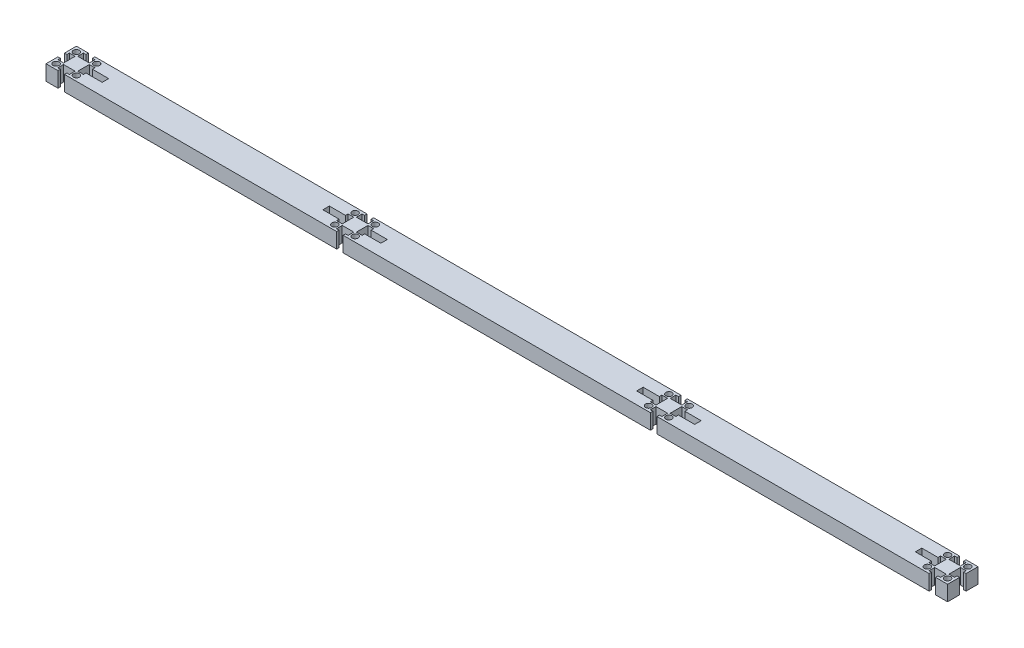
from build123d import *

# Parameters (mm, degrees)
SKETCH1_R           = 1.5
BOSS_EXTRUDE1_DEPTH = 7.5


with BuildPart() as part:
    # Sketch1 → Boss-Extrude1 (new body)
    with BuildSketch(Plane(origin=(0, 0, 0), x_dir=(1, 0, 0), z_dir=(0, 1, 0))):
        Polygon((0, 5.9), (0, 0), (5.9, 0), (5.9, 1.2), (4.65, 1.2), (4.65, 4), (10.35, 4), (10.35, 1.2), (9.1, 1.2), (9.1, 0), (143.3, 0), (143.3, 1.2), (142.05, 1.2), (142.05, 4), (147.75, 4), (147.75, 1.2), (146.5, 1.2), (146.5, 0), (298, 0), (298, 1.2), (296.75, 1.2), (296.75, 4), (302.45, 4), (302.45, 1.2), (301.2, 1.2), (301.2, 0), (435.4, 0), (435.4, 1.2), (434.15, 1.2), (434.15, 4), (439.85, 4), (439.85, 1.2), (438.6, 1.2), (438.6, 0), (444.5, 0), (444.5, 5.9), (443.3, 5.9), (443.3, 4.65), (440.5, 4.65), (440.5, 10.35), (443.3, 10.35), (443.3, 9.1), (444.5, 9.1), (444.5, 15), (438.6, 15), (438.6, 13.8), (439.85, 13.8), (439.85, 11), (434.15, 11), (434.15, 13.8), (435.4, 13.8), (435.4, 15), (301.2, 15), (301.2, 13.8), (302.45, 13.8), (302.45, 11), (296.75, 11), (296.75, 13.8), (298, 13.8), (298, 15), (146.5, 15), (146.5, 13.8), (147.75, 13.8), (147.75, 11), (142.05, 11), (142.05, 13.8), (143.3, 13.8), (143.3, 15), (9.1, 15), (9.1, 13.8), (10.35, 13.8), (10.35, 11), (4.65, 11), (4.65, 13.8), (5.9, 13.8), (5.9, 15), (0, 15), (0, 9.1), (1.2, 9.1), (1.2, 10.35), (4, 10.35), (4, 4.65), (1.2, 4.65), (1.2, 5.9), align=None)
        with Locations((2.5, 2.5)):
            Circle(SKETCH1_R, mode=Mode.SUBTRACT)
        with Locations((12.5, 2.5)):
            Circle(SKETCH1_R, mode=Mode.SUBTRACT)
        Polygon((21.8, 9.1), (21.8, 5.9), (13.8, 5.9), (13.8, 4.65), (11, 4.65), (11, 10.35), (13.8, 10.35), (13.8, 9.1), align=None, mode=Mode.SUBTRACT)
        with Locations((2.5, 12.5)):
            Circle(SKETCH1_R, mode=Mode.SUBTRACT)
        with Locations((12.5, 12.5)):
            Circle(SKETCH1_R, mode=Mode.SUBTRACT)
        with Locations((149.9, 12.5)):
            Circle(SKETCH1_R, mode=Mode.SUBTRACT)
        with Locations((139.9, 2.5)):
            Circle(SKETCH1_R, mode=Mode.SUBTRACT)
        with Locations((149.9, 2.5)):
            Circle(SKETCH1_R, mode=Mode.SUBTRACT)
        Polygon((141.4, 10.35), (141.4, 4.65), (138.6, 4.65), (138.6, 5.9), (130.6, 5.9), (130.6, 9.1), (138.6, 9.1), (138.6, 10.35), align=None, mode=Mode.SUBTRACT)
        Polygon((148.4, 10.35), (151.2, 10.35), (151.2, 9.1), (159.2, 9.1), (159.2, 5.9), (151.2, 5.9), (151.2, 4.65), (148.4, 4.65), align=None, mode=Mode.SUBTRACT)
        with Locations((139.9, 12.5)):
            Circle(SKETCH1_R, mode=Mode.SUBTRACT)
        with Locations((304.6, 12.5)):
            Circle(SKETCH1_R, mode=Mode.SUBTRACT)
        with Locations((294.6, 2.5)):
            Circle(SKETCH1_R, mode=Mode.SUBTRACT)
        with Locations((304.6, 2.5)):
            Circle(SKETCH1_R, mode=Mode.SUBTRACT)
        Polygon((305.9, 4.65), (303.1, 4.65), (303.1, 10.35), (305.9, 10.35), (305.9, 9.1), (313.9, 9.1), (313.9, 5.9), (305.9, 5.9), align=None, mode=Mode.SUBTRACT)
        Polygon((296.1, 10.35), (296.1, 4.65), (293.3, 4.65), (293.3, 5.9), (285.3, 5.9), (285.3, 9.1), (293.3, 9.1), (293.3, 10.35), align=None, mode=Mode.SUBTRACT)
        with Locations((294.6, 12.5)):
            Circle(SKETCH1_R, mode=Mode.SUBTRACT)
        with Locations((442, 12.5)):
            Circle(SKETCH1_R, mode=Mode.SUBTRACT)
        with Locations((432, 2.5)):
            Circle(SKETCH1_R, mode=Mode.SUBTRACT)
        with Locations((442, 2.5)):
            Circle(SKETCH1_R, mode=Mode.SUBTRACT)
        Polygon((430.7, 4.65), (430.7, 5.9), (422.7, 5.9), (422.7, 9.1), (430.7, 9.1), (430.7, 10.35), (433.5, 10.35), (433.5, 4.65), align=None, mode=Mode.SUBTRACT)
        with Locations((432, 12.5)):
            Circle(SKETCH1_R, mode=Mode.SUBTRACT)
    extrude(amount=BOSS_EXTRUDE1_DEPTH)


solid = part.part
